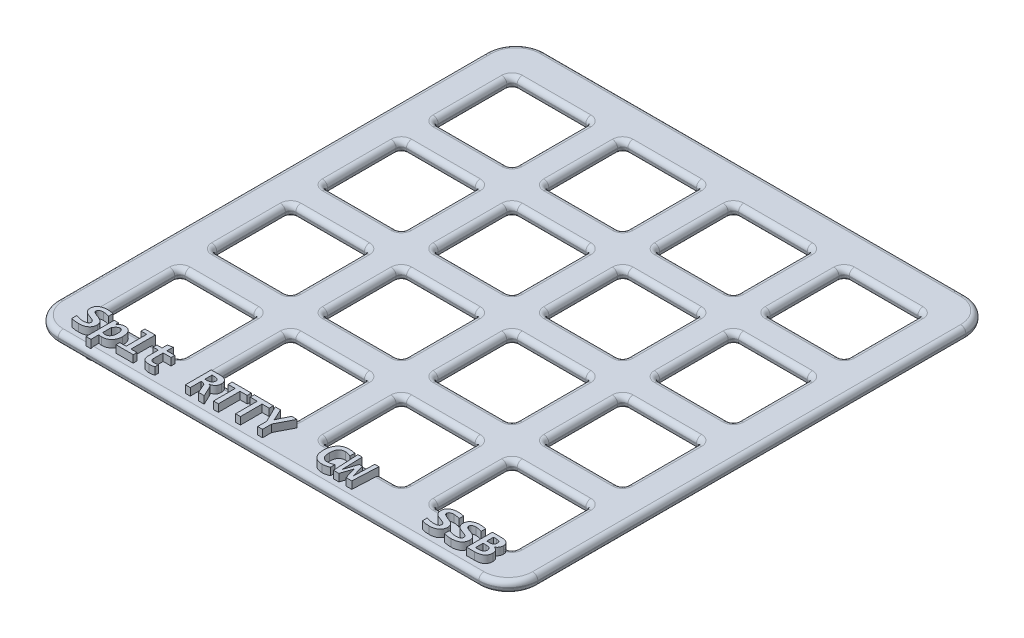
from build123d import *

# Parameters (mm, degrees)
MAIN_DEPTH                       = 1.5
SKETCH2_W                        = 10.7
SKETCH2_H                        = 10.7
BUTTON_HOLE_1_DEPTH              = 93.818144147
BUTTON_FILLET_R                  = 0.7
BUTTONS_BY_16_COUNT              = 4
BUTTONS_BY_16_PITCH              = 15
BUTTONS_BY_16_COUNT_DIR2         = 4
BUTTONS_BY_16_PITCH_DIR2         = 15
BUTTON_FILLET_OF_BUTTONS_BY_16_R = 0.7
OUTER_EDGE_FILLET_R              = 0.7
LETTERING_BOSS_DEPTH             = 2.5


with BuildPart() as part:
    # Sketch1 → main (new body)
    with BuildSketch(Plane(origin=(0, 0, 0), x_dir=(1, 0, 0), z_dir=(0, 1, 0))):
        with BuildLine():
            Line((-14.880741165, -14.535531583), (42.119258835, -14.535531583))
            ThreePointArc((42.119258835, -14.535531583), (44.94768596, -15.707104458), (46.119258835, -18.535531583))
            Line((46.119258835, -18.535531583), (46.119258835, -76.535531583))
            ThreePointArc((46.119258835, -76.535531583), (44.94768596, -79.363958708), (42.119258835, -80.535531583))
            Line((42.119258835, -80.535531583), (-14.880741165, -80.535531583))
            ThreePointArc((-14.880741165, -80.535531583), (-17.709168289, -79.363958708), (-18.880741165, -76.535531583))
            Line((-18.880741165, -76.535531583), (-18.880741165, -18.535531583))
            ThreePointArc((-18.880741165, -18.535531583), (-17.709168289, -15.707104458), (-14.880741165, -14.535531583))
        make_face()
    extrude(amount=MAIN_DEPTH)

    # Sketch2 → button hole 1 (cut, through all)
    with BuildSketch(Plane(origin=(0, 1.5, 0), x_dir=(1, 0, 0), z_dir=(0, 1, 0))):
        with Locations((-8.880741165, -25.035531583)):
            Rectangle(SKETCH2_W, SKETCH2_H)
    button_hole_1 = extrude(amount=-BUTTON_HOLE_1_DEPTH, mode=Mode.SUBTRACT)

    # button fillet
    button_fillet_edges = [part.edges().sort_by_distance(p)[0] for p in [
        (-8.880741165, 0, 30.385531583),
        (-8.880741165, 1.5, 30.385531583),
        (-8.880741165, 0, 19.685531583),
        (-8.880741165, 1.5, 19.685531583),
        (-3.530741165, 0.75, 30.385531583),
        (-3.530741165, 0, 25.035531583),
        (-3.530741165, 0.75, 19.685531583),
        (-3.530741165, 1.5, 25.035531583),
        (-14.230741165, 0.75, 19.685531583),
        (-14.230741165, 0, 25.035531583),
        (-14.230741165, 0.75, 30.385531583),
        (-14.230741165, 1.5, 25.035531583),
    ]]
    fillet(button_fillet_edges, radius=BUTTON_FILLET_R)

    # buttons by 16: button hole 1 4 × 4
    with Locations(*[(i * BUTTONS_BY_16_PITCH, 0, j * BUTTONS_BY_16_PITCH_DIR2) for i in range(BUTTONS_BY_16_COUNT) for j in range(BUTTONS_BY_16_COUNT_DIR2) if (i, j) != (0, 0)]):
        add(button_hole_1, mode=Mode.SUBTRACT)

    # button fillet of buttons by 16
    button_fillet_of_buttons_by_16_edges = [part.edges().sort_by_distance(p)[0] for p in [
        (-8.880741165, 0, 45.385531583),
        (-8.880741165, 1.5, 45.385531583),
        (-8.880741165, 0, 34.685531583),
        (-8.880741165, 1.5, 34.685531583),
        (-3.530741165, 0.75, 45.385531583),
        (-3.530741165, 0, 40.035531583),
        (-3.530741165, 0.75, 34.685531583),
        (-3.530741165, 1.5, 40.035531583),
        (-14.230741165, 0.75, 34.685531583),
        (-14.230741165, 0, 40.035531583),
        (-14.230741165, 0.75, 45.385531583),
        (-14.230741165, 1.5, 40.035531583),
        (-8.880741165, 0, 60.385531583),
        (-8.880741165, 1.5, 60.385531583),
        (-8.880741165, 0, 49.685531583),
        (-8.880741165, 1.5, 49.685531583),
        (-3.530741165, 0.75, 60.385531583),
        (-3.530741165, 0, 55.035531583),
        (-3.530741165, 0.75, 49.685531583),
        (-3.530741165, 1.5, 55.035531583),
        (-14.230741165, 0.75, 49.685531583),
        (-14.230741165, 0, 55.035531583),
        (-14.230741165, 0.75, 60.385531583),
        (-14.230741165, 1.5, 55.035531583),
        (-8.880741165, 0, 75.385531583),
        (-8.880741165, 1.5, 75.385531583),
        (-8.880741165, 0, 64.685531583),
        (-8.880741165, 1.5, 64.685531583),
        (-3.530741165, 0.75, 75.385531583),
        (-3.530741165, 0, 70.035531583),
        (-3.530741165, 0.75, 64.685531583),
        (-3.530741165, 1.5, 70.035531583),
        (-14.230741165, 0.75, 64.685531583),
        (-14.230741165, 0, 70.035531583),
        (-14.230741165, 0.75, 75.385531583),
        (-14.230741165, 1.5, 70.035531583),
        (6.119258835, 0, 30.385531583),
        (6.119258835, 1.5, 30.385531583),
        (6.119258835, 0, 19.685531583),
        (6.119258835, 1.5, 19.685531583),
        (11.469258835, 0.75, 30.385531583),
        (11.469258835, 0, 25.035531583),
        (11.469258835, 0.75, 19.685531583),
        (11.469258835, 1.5, 25.035531583),
        (0.769258835, 0.75, 19.685531583),
        (0.769258835, 0, 25.035531583),
        (0.769258835, 0.75, 30.385531583),
        (0.769258835, 1.5, 25.035531583),
        (6.119258835, 0, 45.385531583),
        (6.119258835, 1.5, 45.385531583),
        (6.119258835, 0, 34.685531583),
        (6.119258835, 1.5, 34.685531583),
        (11.469258835, 0.75, 45.385531583),
        (11.469258835, 0, 40.035531583),
        (11.469258835, 0.75, 34.685531583),
        (11.469258835, 1.5, 40.035531583),
        (0.769258835, 0.75, 34.685531583),
        (0.769258835, 0, 40.035531583),
        (0.769258835, 0.75, 45.385531583),
        (0.769258835, 1.5, 40.035531583),
        (6.119258835, 0, 60.385531583),
        (6.119258835, 1.5, 60.385531583),
        (6.119258835, 0, 49.685531583),
        (6.119258835, 1.5, 49.685531583),
        (11.469258835, 0.75, 60.385531583),
        (11.469258835, 0, 55.035531583),
        (11.469258835, 0.75, 49.685531583),
        (11.469258835, 1.5, 55.035531583),
        (0.769258835, 0.75, 49.685531583),
        (0.769258835, 0, 55.035531583),
        (0.769258835, 0.75, 60.385531583),
        (0.769258835, 1.5, 55.035531583),
        (6.119258835, 0, 75.385531583),
        (6.119258835, 1.5, 75.385531583),
        (6.119258835, 0, 64.685531583),
        (6.119258835, 1.5, 64.685531583),
        (11.469258835, 0.75, 75.385531583),
        (11.469258835, 0, 70.035531583),
        (11.469258835, 0.75, 64.685531583),
        (11.469258835, 1.5, 70.035531583),
        (0.769258835, 0.75, 64.685531583),
        (0.769258835, 0, 70.035531583),
        (0.769258835, 0.75, 75.385531583),
        (0.769258835, 1.5, 70.035531583),
        (21.119258835, 0, 30.385531583),
        (21.119258835, 1.5, 30.385531583),
        (21.119258835, 0, 19.685531583),
        (21.119258835, 1.5, 19.685531583),
        (26.469258835, 0.75, 30.385531583),
        (26.469258835, 0, 25.035531583),
        (26.469258835, 0.75, 19.685531583),
        (26.469258835, 1.5, 25.035531583),
        (15.769258835, 0.75, 19.685531583),
        (15.769258835, 0, 25.035531583),
        (15.769258835, 0.75, 30.385531583),
        (15.769258835, 1.5, 25.035531583),
        (21.119258835, 0, 45.385531583),
        (21.119258835, 1.5, 45.385531583),
        (21.119258835, 0, 34.685531583),
        (21.119258835, 1.5, 34.685531583),
        (26.469258835, 0.75, 45.385531583),
        (26.469258835, 0, 40.035531583),
        (26.469258835, 0.75, 34.685531583),
        (26.469258835, 1.5, 40.035531583),
        (15.769258835, 0.75, 34.685531583),
        (15.769258835, 0, 40.035531583),
        (15.769258835, 0.75, 45.385531583),
        (15.769258835, 1.5, 40.035531583),
        (21.119258835, 0, 60.385531583),
        (21.119258835, 1.5, 60.385531583),
        (21.119258835, 0, 49.685531583),
        (21.119258835, 1.5, 49.685531583),
        (26.469258835, 0.75, 60.385531583),
        (26.469258835, 0, 55.035531583),
        (26.469258835, 0.75, 49.685531583),
        (26.469258835, 1.5, 55.035531583),
        (15.769258835, 0.75, 49.685531583),
        (15.769258835, 0, 55.035531583),
        (15.769258835, 0.75, 60.385531583),
        (15.769258835, 1.5, 55.035531583),
        (21.119258835, 0, 75.385531583),
        (21.119258835, 1.5, 75.385531583),
        (21.119258835, 0, 64.685531583),
        (21.119258835, 1.5, 64.685531583),
        (26.469258835, 0.75, 75.385531583),
        (26.469258835, 0, 70.035531583),
        (26.469258835, 0.75, 64.685531583),
        (26.469258835, 1.5, 70.035531583),
        (15.769258835, 0.75, 64.685531583),
        (15.769258835, 0, 70.035531583),
        (15.769258835, 0.75, 75.385531583),
        (15.769258835, 1.5, 70.035531583),
        (36.119258835, 0, 30.385531583),
        (36.119258835, 1.5, 30.385531583),
        (36.119258835, 0, 19.685531583),
        (36.119258835, 1.5, 19.685531583),
        (41.469258835, 0.75, 30.385531583),
        (41.469258835, 0, 25.035531583),
        (41.469258835, 0.75, 19.685531583),
        (41.469258835, 1.5, 25.035531583),
        (30.769258835, 0.75, 19.685531583),
        (30.769258835, 0, 25.035531583),
        (30.769258835, 0.75, 30.385531583),
        (30.769258835, 1.5, 25.035531583),
        (36.119258835, 0, 45.385531583),
        (36.119258835, 1.5, 45.385531583),
        (36.119258835, 0, 34.685531583),
        (36.119258835, 1.5, 34.685531583),
        (41.469258835, 0.75, 45.385531583),
        (41.469258835, 0, 40.035531583),
        (41.469258835, 0.75, 34.685531583),
        (41.469258835, 1.5, 40.035531583),
        (30.769258835, 0.75, 34.685531583),
        (30.769258835, 0, 40.035531583),
        (30.769258835, 0.75, 45.385531583),
        (30.769258835, 1.5, 40.035531583),
        (36.119258835, 0, 60.385531583),
        (36.119258835, 1.5, 60.385531583),
        (36.119258835, 0, 49.685531583),
        (36.119258835, 1.5, 49.685531583),
        (41.469258835, 0.75, 60.385531583),
        (41.469258835, 0, 55.035531583),
        (41.469258835, 0.75, 49.685531583),
        (41.469258835, 1.5, 55.035531583),
        (30.769258835, 0.75, 49.685531583),
        (30.769258835, 0, 55.035531583),
        (30.769258835, 0.75, 60.385531583),
        (30.769258835, 1.5, 55.035531583),
        (36.119258835, 0, 75.385531583),
        (36.119258835, 1.5, 75.385531583),
        (36.119258835, 0, 64.685531583),
        (36.119258835, 1.5, 64.685531583),
        (41.469258835, 0.75, 75.385531583),
        (41.469258835, 0, 70.035531583),
        (41.469258835, 0.75, 64.685531583),
        (41.469258835, 1.5, 70.035531583),
        (30.769258835, 0.75, 64.685531583),
        (30.769258835, 0, 70.035531583),
        (30.769258835, 0.75, 75.385531583),
        (30.769258835, 1.5, 70.035531583),
    ]]
    fillet(button_fillet_of_buttons_by_16_edges, radius=BUTTON_FILLET_OF_BUTTONS_BY_16_R)

    # outer edge fillet
    outer_edge_fillet_edges = [part.edges().sort_by_distance(p)[0] for p in [
        (13.619258835, 1.5, 14.535531583),
        (13.619258835, 0, 14.535531583),
        (46.119258835, 1.5, 47.535531583),
        (46.119258835, 0, 47.535531583),
        (13.619258835, 1.5, 80.535531583),
        (13.619258835, 0, 80.535531583),
        (-18.880741165, 1.5, 47.535531583),
        (-18.880741165, 0, 47.535531583),
        (44.94768596, 1.5, 15.707104458),
        (44.94768596, 1.5, 79.363958708),
        (-17.709168289, 1.5, 79.363958708),
        (-17.709168289, 1.5, 15.707104458),
        (44.94768596, 0, 15.707104458),
        (44.94768596, 0, 79.363958708),
        (-17.709168289, 0, 79.363958708),
        (-17.709168289, 0, 15.707104458),
    ]]
    fillet(outer_edge_fillet_edges, radius=OUTER_EDGE_FILLET_R)

    # Lettering → lettering boss (add)
    # profile 1 of 13: a face of its own
    with BuildSketch(Plane(origin=(0, 0, 0), x_dir=(1, 0, 0), z_dir=(0, 1, 0))):
        with BuildLine():
            add(Edge.make_bspline(
                [(35.461192996, -78.072691909), (35.460219938, -78.118754507), (35.458330304, -78.208205957), (35.436683824, -78.337558753), (35.404146648, -78.458150303), (35.356871415, -78.569020514), (35.297849953, -78.670145601), (35.228271235, -78.762346077), (35.147849394, -78.84512241), (35.056676983, -78.918182679), (34.956202124, -78.982599991), (34.846563905, -79.03817851), (34.727356813, -79.083922022), (34.60014988, -79.121727685), (34.465263025, -79.150939713), (34.323804391, -79.171063334), (34.17615797, -79.184325826), (34.075541922, -79.185604497), (34.02425912, -79.186256221)],
                knots=[0, 0, 0, 0, 1.073681499, 2.085040185, 3.051149047, 3.981944283, 4.887978953, 5.776845786, 6.670466122, 7.573455289, 8.49677068, 9.450589821, 10.436166866, 11.471749255, 12.544173733, 13.653021529, 14.803772988, 16, 16, 16, 16], degree=3))
            add(Edge.make_bspline(
                [(34.02425912, -79.186256221), (33.933317541, -79.184576543), (33.753956378, -79.181263769), (33.48856806, -79.155083882), (33.228676809, -79.108055718), (33.060379735, -79.058846435), (32.97568575, -79.034082307)],
                knots=[0, 0, 0, 0, 1.025764599, 2.023082686, 3.005134181, 4, 4, 4, 4], degree=3))
            Line((32.97568575, -79.034082307), (32.97568575, -78.374662018))
            add(Edge.make_bspline(
                [(32.97568575, -78.374662018), (33.018439663, -78.388274658), (33.105246895, -78.415913665), (33.237527488, -78.455161652), (33.373409396, -78.488440968), (33.51010859, -78.519067388), (33.647120187, -78.54339105), (33.783175795, -78.562708611), (33.917032304, -78.575143008), (34.005476579, -78.576765352), (34.048828866, -78.577560568)],
                knots=[0, 0, 0, 0, 0.982138956, 1.994127776, 3.019379675, 4.043652595, 5.060010385, 6.064286964, 7.051181246, 8, 8, 8, 8], degree=3))
            add(Edge.make_bspline(
                [(34.048828866, -78.577560568), (34.079483437, -78.577344081), (34.138206785, -78.576929368), (34.222883387, -78.571371353), (34.300112613, -78.561920475), (34.370914891, -78.549490037), (34.434595377, -78.532763313), (34.492509693, -78.513882948), (34.54389405, -78.491729123), (34.589828685, -78.467217621), (34.629193063, -78.439492495), (34.663478373, -78.409932443), (34.69132107, -78.377177044), (34.720998052, -78.330630302), (34.745804733, -78.265164811), (34.74928272, -78.210044658), (34.751048069, -78.182066909)],
                knots=[0, 0, 0, 0, 1.428616996, 2.73672639, 3.952495327, 5.053878092, 6.0842745, 7.018828766, 7.890331589, 8.689308687, 9.440856164, 10.130100935, 10.793906804, 11.436117796, 12.698631087, 14, 14, 14, 14], degree=3))
            add(Edge.make_bspline(
                [(34.751048069, -78.182066909), (34.750093692, -78.161661255), (34.748237167, -78.121966637), (34.734977728, -78.064648206), (34.71040196, -78.013113569), (34.677322971, -77.966756363), (34.636551645, -77.924783594), (34.59117636, -77.883974108), (34.53783873, -77.848048065), (34.459156631, -77.800395294), (34.347847102, -77.747085562), (34.201586397, -77.693270589), (34.046689287, -77.638936463), (33.887415467, -77.581490004), (33.728896916, -77.515390595), (33.597775581, -77.456259305), (33.496922977, -77.401704077), (33.425727716, -77.355764053), (33.358644273, -77.305232749), (33.294998405, -77.251068159), (33.236891983, -77.190722285), (33.185463063, -77.12446183), (33.138954468, -77.053357109), (33.09830093, -76.976509382), (33.065054636, -76.892254134), (33.042671403, -76.799998883), (33.02904602, -76.699835006), (33.027310942, -76.630520469), (33.026410388, -76.594544264)],
                knots=[0, 0, 0, 0, 0.628577789, 1.222756944, 1.798018064, 2.376093337, 2.969100815, 3.597678604, 4.252424917, 4.946124793, 6.431204757, 8.043936516, 9.745465074, 11.488681512, 13.25853968, 15.035457213, 15.916880054, 16.788288763, 17.642849837, 18.502665518, 19.360321436, 20.218324825, 21.082903639, 21.974822425, 22.892221362, 23.865363472, 24.892063288, 26, 26, 26, 26], degree=3))
            add(Edge.make_bspline(
                [(33.026410388, -76.594544264), (33.027274108, -76.560670177), (33.0289824, -76.493673001), (33.04415211, -76.394792401), (33.066631419, -76.298171014), (33.100120009, -76.205000982), (33.142627892, -76.115346769), (33.197269293, -76.031893245), (33.261663821, -75.95351691), (33.337769728, -75.881972697), (33.424562998, -75.816652376), (33.523012291, -75.75903275), (33.631968598, -75.707026656), (33.753180736, -75.663973457), (33.886225231, -75.62760361), (34.032541014, -75.603386426), (34.19163711, -75.586761566), (34.302140038, -75.585474986), (34.359517272, -75.584806945)],
                knots=[0, 0, 0, 0, 0.86106195, 1.703033948, 2.539139973, 3.380790137, 4.216301896, 5.056905248, 5.911254958, 6.790607679, 7.707171391, 8.668295362, 9.687250551, 10.773449095, 11.935660323, 13.190638171, 14.54127474, 16, 16, 16, 16], degree=3))
            add(Edge.make_bspline(
                [(34.359517272, -75.584806945), (34.395192595, -75.585328122), (34.468179527, -75.586394381), (34.578896885, -75.593192523), (34.69124805, -75.602352865), (34.802717558, -75.615291702), (34.911655597, -75.62997727), (35.01615136, -75.647768483), (35.114685419, -75.665116669), (35.177500591, -75.67941277), (35.207569808, -75.686256221)],
                knots=[0, 0, 0, 0, 1.000632186, 2.047159369, 3.110551158, 4.162103459, 5.194366354, 6.193323381, 7.135155576, 8, 8, 8, 8], degree=3))
            Line((35.207569808, -75.686256221), (35.207569808, -76.294951873))
            add(Edge.make_bspline(
                [(35.207569808, -76.294951873), (35.17755424, -76.284076418), (35.115389321, -76.261552381), (35.017882443, -76.233039217), (34.914896829, -76.206571669), (34.807944602, -76.184965323), (34.698833511, -76.166419449), (34.589839247, -76.153504356), (34.483329743, -76.143838304), (34.413432739, -76.143125648), (34.379331583, -76.14277796)],
                knots=[0, 0, 0, 0, 0.905300762, 1.874958649, 2.879989676, 3.920459461, 4.968805495, 6.018141936, 7.033096622, 8, 8, 8, 8], degree=3))
            add(Edge.make_bspline(
                [(34.379331583, -76.14277796), (34.351314338, -76.142973959), (34.297332983, -76.143351593), (34.219861571, -76.149221763), (34.14880624, -76.157352156), (34.084645979, -76.170438094), (34.026198867, -76.185096368), (33.973856888, -76.20350348), (33.926411551, -76.223964621), (33.884590384, -76.247790061), (33.847391354, -76.273528612), (33.817014432, -76.303956514), (33.790458948, -76.335782043), (33.764272916, -76.383308933), (33.741009556, -76.448817433), (33.738068433, -76.504220459), (33.736555315, -76.532723612)],
                knots=[0, 0, 0, 0, 1.388230333, 2.674729552, 3.848979118, 4.930101904, 5.917823404, 6.833012122, 7.677256906, 8.474713018, 9.216010271, 9.910495862, 10.599653, 11.262301414, 12.591538262, 14, 14, 14, 14], degree=3))
            add(Edge.make_bspline(
                [(33.736555315, -76.532723612), (33.737455619, -76.550519959), (33.739203448, -76.585069351), (33.753342619, -76.634928436), (33.77654148, -76.680867781), (33.809977093, -76.722004976), (33.850319289, -76.760011163), (33.896270924, -76.796655217), (33.94898437, -76.830353208), (34.028107231, -76.87474687), (34.139650508, -76.92480093), (34.284653433, -76.981066224), (34.44056414, -77.034816895), (34.599699077, -77.095990815), (34.759872573, -77.161027453), (34.889713197, -77.224533677), (34.9907355, -77.279743737), (35.061879067, -77.32656744), (35.129020188, -77.377817306), (35.192166921, -77.432762858), (35.25066594, -77.492554967), (35.303221834, -77.557665228), (35.349075684, -77.628483676), (35.389232061, -77.704335812), (35.422153956, -77.786142297), (35.445100252, -77.875348129), (35.458456558, -77.971628224), (35.46026189, -78.03830377), (35.461192996, -78.072691909)],
                knots=[0, 0, 0, 0, 0.557156268, 1.081649532, 1.611348813, 2.159818371, 2.733894156, 3.347031838, 3.999468898, 4.692937397, 6.19005387, 7.82657883, 9.568786128, 11.359307707, 13.171290529, 14.986394118, 15.88741221, 16.778746798, 17.653416553, 18.53387112, 19.400741367, 20.27258301, 21.152453011, 22.041629961, 22.959843454, 23.910073311, 24.922113205, 26, 26, 26, 26], degree=3))
        make_face()
    # profile 2 of 13: a face of its own
    with BuildSketch(Plane(origin=(0, 0, 0), x_dir=(1, 0, 0), z_dir=(0, 1, 0))):
        with BuildLine():
            add(Edge.make_bspline(
                [(38.45394662, -78.072691909), (38.452973561, -78.118754507), (38.451083927, -78.208205957), (38.429437447, -78.337558753), (38.396900271, -78.458150303), (38.349625038, -78.569020514), (38.290603576, -78.670145601), (38.221024858, -78.762346077), (38.140603017, -78.84512241), (38.049430606, -78.918182679), (37.948955747, -78.982599991), (37.839317528, -79.03817851), (37.720110436, -79.083922022), (37.592903503, -79.121727685), (37.458016648, -79.150939713), (37.316558014, -79.171063334), (37.168911593, -79.184325826), (37.068295545, -79.185604497), (37.017012743, -79.186256221)],
                knots=[0, 0, 0, 0, 1.073681499, 2.085040185, 3.051149047, 3.981944283, 4.887978953, 5.776845786, 6.670466122, 7.573455289, 8.49677068, 9.450589821, 10.436166866, 11.471749255, 12.544173733, 13.653021529, 14.803772988, 16, 16, 16, 16], degree=3))
            add(Edge.make_bspline(
                [(37.017012743, -79.186256221), (36.926071164, -79.184576543), (36.746710001, -79.181263769), (36.481321683, -79.155083882), (36.221430432, -79.108055718), (36.053133358, -79.058846435), (35.968439373, -79.034082307)],
                knots=[0, 0, 0, 0, 1.025764599, 2.023082686, 3.005134181, 4, 4, 4, 4], degree=3))
            Line((35.968439373, -79.034082307), (35.968439373, -78.374662018))
            add(Edge.make_bspline(
                [(35.968439373, -78.374662018), (36.011193286, -78.388274658), (36.098000518, -78.415913665), (36.230281112, -78.455161652), (36.366163019, -78.488440968), (36.502862214, -78.519067388), (36.63987381, -78.54339105), (36.775929418, -78.562708611), (36.909785927, -78.575143008), (36.998230202, -78.576765352), (37.041582489, -78.577560568)],
                knots=[0, 0, 0, 0, 0.982138956, 1.994127776, 3.019379675, 4.043652595, 5.060010385, 6.064286964, 7.051181246, 8, 8, 8, 8], degree=3))
            add(Edge.make_bspline(
                [(37.041582489, -78.577560568), (37.07223706, -78.577344081), (37.130960408, -78.576929368), (37.215637011, -78.571371353), (37.292866237, -78.561920475), (37.363668514, -78.549490037), (37.427349, -78.532763313), (37.485263316, -78.513882948), (37.536647673, -78.491729123), (37.582582308, -78.467217621), (37.621946686, -78.439492495), (37.656231997, -78.409932443), (37.684074693, -78.377177044), (37.713751675, -78.330630302), (37.738558356, -78.265164811), (37.742036344, -78.210044658), (37.743801692, -78.182066909)],
                knots=[0, 0, 0, 0, 1.428616996, 2.73672639, 3.952495327, 5.053878092, 6.0842745, 7.018828766, 7.890331589, 8.689308687, 9.440856164, 10.130100935, 10.793906804, 11.436117796, 12.698631087, 14, 14, 14, 14], degree=3))
            add(Edge.make_bspline(
                [(37.743801692, -78.182066909), (37.742847315, -78.161661255), (37.74099079, -78.121966637), (37.727731351, -78.064648206), (37.703155584, -78.013113569), (37.670076594, -77.966756363), (37.629305268, -77.924783594), (37.583929984, -77.883974108), (37.530592353, -77.848048065), (37.451910254, -77.800395294), (37.340600725, -77.747085562), (37.194340021, -77.693270589), (37.03944291, -77.638936463), (36.880169091, -77.581490004), (36.721650539, -77.515390595), (36.590529204, -77.456259305), (36.4896766, -77.401704077), (36.41848134, -77.355764053), (36.351397896, -77.305232749), (36.287752028, -77.251068159), (36.229645607, -77.190722285), (36.178216686, -77.12446183), (36.131708091, -77.053357109), (36.091054553, -76.976509382), (36.057808259, -76.892254134), (36.035425026, -76.799998883), (36.021799643, -76.699835006), (36.020064565, -76.630520469), (36.019164011, -76.594544264)],
                knots=[0, 0, 0, 0, 0.628577789, 1.222756944, 1.798018064, 2.376093337, 2.969100815, 3.597678604, 4.252424917, 4.946124793, 6.431204757, 8.043936516, 9.745465074, 11.488681512, 13.25853968, 15.035457213, 15.916880054, 16.788288763, 17.642849837, 18.502665518, 19.360321436, 20.218324825, 21.082903639, 21.974822425, 22.892221362, 23.865363472, 24.892063288, 26, 26, 26, 26], degree=3))
            add(Edge.make_bspline(
                [(36.019164011, -76.594544264), (36.020027731, -76.560670177), (36.021736023, -76.493673001), (36.036905733, -76.394792401), (36.059385043, -76.298171014), (36.092873632, -76.205000982), (36.135381515, -76.115346769), (36.190022916, -76.031893245), (36.254417445, -75.95351691), (36.330523351, -75.881972697), (36.417316621, -75.816652376), (36.515765914, -75.75903275), (36.624722222, -75.707026656), (36.745934359, -75.663973457), (36.878978854, -75.62760361), (37.025294637, -75.603386426), (37.184390733, -75.586761566), (37.294893661, -75.585474986), (37.352270895, -75.584806945)],
                knots=[0, 0, 0, 0, 0.86106195, 1.703033948, 2.539139973, 3.380790137, 4.216301896, 5.056905248, 5.911254958, 6.790607679, 7.707171391, 8.668295362, 9.687250551, 10.773449095, 11.935660323, 13.190638171, 14.54127474, 16, 16, 16, 16], degree=3))
            add(Edge.make_bspline(
                [(37.352270895, -75.584806945), (37.387946219, -75.585328122), (37.460933151, -75.586394381), (37.571650508, -75.593192523), (37.684001673, -75.602352865), (37.795471181, -75.615291702), (37.90440922, -75.62997727), (38.008904983, -75.647768483), (38.107439042, -75.665116669), (38.170254214, -75.67941277), (38.200323431, -75.686256221)],
                knots=[0, 0, 0, 0, 1.000632186, 2.047159369, 3.110551158, 4.162103459, 5.194366354, 6.193323381, 7.135155576, 8, 8, 8, 8], degree=3))
            Line((38.200323431, -75.686256221), (38.200323431, -76.294951873))
            add(Edge.make_bspline(
                [(38.200323431, -76.294951873), (38.170307863, -76.284076418), (38.108142944, -76.261552381), (38.010636066, -76.233039217), (37.907650453, -76.206571669), (37.800698225, -76.184965323), (37.691587134, -76.166419449), (37.582592871, -76.153504356), (37.476083366, -76.143838304), (37.406186362, -76.143125648), (37.372085206, -76.14277796)],
                knots=[0, 0, 0, 0, 0.905300762, 1.874958649, 2.879989676, 3.920459461, 4.968805495, 6.018141936, 7.033096622, 8, 8, 8, 8], degree=3))
            add(Edge.make_bspline(
                [(37.372085206, -76.14277796), (37.344067961, -76.142973959), (37.290086606, -76.143351593), (37.212615194, -76.149221763), (37.141559863, -76.157352156), (37.077399603, -76.170438094), (37.018952491, -76.185096368), (36.966610512, -76.20350348), (36.919165174, -76.223964621), (36.877344007, -76.247790061), (36.840144977, -76.273528612), (36.809768055, -76.303956514), (36.783212571, -76.335782043), (36.75702654, -76.383308933), (36.733763179, -76.448817433), (36.730822056, -76.504220459), (36.729308938, -76.532723612)],
                knots=[0, 0, 0, 0, 1.388230333, 2.674729552, 3.848979118, 4.930101904, 5.917823404, 6.833012122, 7.677256906, 8.474713018, 9.216010271, 9.910495862, 10.599653, 11.262301414, 12.591538262, 14, 14, 14, 14], degree=3))
            add(Edge.make_bspline(
                [(36.729308938, -76.532723612), (36.730209243, -76.550519959), (36.731957071, -76.585069351), (36.746096242, -76.634928436), (36.769295103, -76.680867781), (36.802730716, -76.722004976), (36.843072912, -76.760011163), (36.889024547, -76.796655217), (36.941737994, -76.830353208), (37.020860854, -76.87474687), (37.132404131, -76.92480093), (37.277407056, -76.981066224), (37.433317763, -77.034816895), (37.5924527, -77.095990815), (37.752626196, -77.161027453), (37.88246682, -77.224533677), (37.983489123, -77.279743737), (38.05463269, -77.32656744), (38.121773811, -77.377817306), (38.184920545, -77.432762858), (38.243419563, -77.492554967), (38.295975457, -77.557665228), (38.341829308, -77.628483676), (38.381985684, -77.704335812), (38.414907579, -77.786142297), (38.437853875, -77.875348129), (38.451210181, -77.971628224), (38.453015513, -78.03830377), (38.45394662, -78.072691909)],
                knots=[0, 0, 0, 0, 0.557156268, 1.081649532, 1.611348813, 2.159818371, 2.733894156, 3.347031838, 3.999468898, 4.692937397, 6.19005387, 7.82657883, 9.568786128, 11.359307707, 13.171290529, 14.986394118, 15.88741221, 16.778746798, 17.653416553, 18.53387112, 19.400741367, 20.27258301, 21.152453011, 22.041629961, 22.959843454, 23.910073311, 24.922113205, 26, 26, 26, 26], degree=3))
        make_face()
    # profile 3 of 13: a face of its own
    with BuildSketch(Plane(origin=(0, 0, 0), x_dir=(1, 0, 0), z_dir=(0, 1, 0))):
        with BuildLine():
            Line((39.062642272, -79.135531583), (39.062642272, -75.635531583))
            Line((39.062642272, -75.635531583), (40.196813467, -75.635531583))
            add(Edge.make_bspline(
                [(40.196813467, -75.635531583), (40.245178192, -75.636098997), (40.339100088, -75.637200886), (40.475072573, -75.646831719), (40.601988486, -75.662103475), (40.719094589, -75.685470439), (40.827637444, -75.713092876), (40.926127576, -75.749469373), (41.016418561, -75.789675513), (41.096258805, -75.838884443), (41.167381398, -75.893170298), (41.228583951, -75.955192176), (41.279894106, -76.023765881), (41.324008733, -76.098126161), (41.35584414, -76.180270745), (41.378838044, -76.268578041), (41.393476313, -76.363157751), (41.395127413, -76.428577606), (41.395975605, -76.462184663)],
                knots=[0, 0, 0, 0, 1.402020869, 2.722654989, 3.950110139, 5.105271457, 6.182839017, 7.193223738, 8.145991228, 9.043198014, 9.905766409, 10.734443583, 11.560141935, 12.38384842, 13.232981204, 14.104313047, 15.026160196, 16, 16, 16, 16], degree=3))
            add(Edge.make_bspline(
                [(41.395975605, -76.462184663), (41.394372626, -76.504813464), (41.391183109, -76.58963387), (41.368095766, -76.714076062), (41.328733885, -76.83209865), (41.272052643, -76.94074928), (41.199153957, -77.038790152), (41.124952646, -77.109755322), (41.057732342, -77.158978767), (41.002853054, -77.192666373), (40.943155755, -77.221083099), (40.901274304, -77.236583879), (40.880010931, -77.244453684)],
                knots=[0, 0, 0, 0, 1.273298406, 2.533538006, 3.766639183, 4.977638108, 6.179029059, 7.401702507, 8.028476186, 8.666091093, 9.322769338, 10, 10, 10, 10], degree=3))
            add(Edge.make_bspline(
                [(40.880010931, -77.244453684), (40.924092927, -77.253415804), (41.012836537, -77.271457884), (41.116554626, -77.318521271), (41.195993826, -77.362677478), (41.250483299, -77.403312963), (41.302800019, -77.446555681), (41.349864078, -77.496071487), (41.393939622, -77.54913733), (41.432746479, -77.607005498), (41.46625352, -77.669844968), (41.495445454, -77.736781767), (41.519493225, -77.807971431), (41.535981335, -77.883719883), (41.546598448, -77.963276751), (41.547627121, -78.017969474), (41.548149518, -78.045744445)],
                knots=[0, 0, 0, 0, 1.6519262, 3.32557291, 4.166740498, 4.995835318, 5.824301884, 6.663779587, 7.507195088, 8.362647254, 9.224604015, 10.126598034, 11.049652309, 11.986803716, 12.977625078, 14, 14, 14, 14], degree=3))
            add(Edge.make_bspline(
                [(41.548149518, -78.045744445), (41.54724251, -78.089669343), (41.545475463, -78.175244507), (41.527219579, -78.299103252), (41.500235564, -78.414986027), (41.460524003, -78.522200043), (41.408203846, -78.620157753), (41.346450718, -78.710946587), (41.271624649, -78.792076902), (41.186413706, -78.865448196), (41.090213209, -78.929637807), (40.983367952, -78.984086709), (40.867860841, -79.032123105), (40.741482345, -79.069455019), (40.605764744, -79.100136652), (40.459303344, -79.119394737), (40.303309725, -79.133966189), (40.195795086, -79.135000187), (40.140540822, -79.135531583)],
                knots=[0, 0, 0, 0, 1.039371005, 2.024918617, 2.958047709, 3.852767572, 4.723053758, 5.582001921, 6.445494094, 7.328259018, 8.239147345, 9.176460892, 10.16391264, 11.196919877, 12.292741297, 13.455226912, 14.692182175, 16, 16, 16, 16], degree=3))
            Line((40.140540822, -79.135531583), (39.062642272, -79.135531583))
        make_face()
        with BuildLine():
            add(Edge.make_bspline(
                [(40.685830677, -76.569974518), (40.684401154, -76.53891651), (40.681630525, -76.478721492), (40.661354014, -76.40650229), (40.636751108, -76.35504987), (40.614243654, -76.319357793), (40.586631643, -76.286895266), (40.55329766, -76.258265835), (40.516045453, -76.231922328), (40.473677339, -76.209016138), (40.42646163, -76.189043088), (40.374106158, -76.172754776), (40.316716069, -76.158972472), (40.253562026, -76.150014365), (40.184810704, -76.143134329), (40.136862043, -76.14289962), (40.112008214, -76.14277796)],
                knots=[0, 0, 0, 0, 1.599357931, 3.099792517, 3.824733362, 4.535069213, 5.269290696, 6.012427379, 6.794603599, 7.61746315, 8.490210935, 9.433542011, 10.441150938, 11.529478764, 12.719423833, 14, 14, 14, 14], degree=3))
            Line((40.112008214, -76.14277796), (39.722062562, -76.14277796))
            Line((39.722062562, -76.14277796), (39.722062562, -77.055821438))
            Line((39.722062562, -77.055821438), (40.112008214, -77.055821438))
            add(Edge.make_bspline(
                [(40.112008214, -77.055821438), (40.137388214, -77.055404031), (40.18614316, -77.054602193), (40.256124072, -77.047461043), (40.319811536, -77.03577893), (40.377580771, -77.019327924), (40.429376677, -76.997195067), (40.47683517, -76.973436582), (40.518959181, -76.944934479), (40.567874298, -76.903296933), (40.619272464, -76.843207997), (40.658512558, -76.758164879), (40.682381985, -76.666409386), (40.684663132, -76.602622272), (40.685830677, -76.569974518)],
                knots=[0, 0, 0, 0, 1.069032976, 2.053610886, 2.959553848, 3.794328356, 4.577732592, 5.329421169, 6.02708937, 6.714020821, 8.033657071, 9.318040837, 10.627309837, 12, 12, 12, 12], degree=3))
        make_face(mode=Mode.SUBTRACT)
        with BuildLine():
            add(Edge.make_bspline(
                [(40.188887743, -78.577560568), (40.214801479, -78.577203479), (40.265174226, -78.576509345), (40.338027559, -78.568323342), (40.405891039, -78.55576795), (40.468842809, -78.538479154), (40.526992632, -78.515934067), (40.580508564, -78.490326919), (40.629195694, -78.460415626), (40.672572093, -78.426662532), (40.710771693, -78.388674303), (40.745390638, -78.348885563), (40.772948616, -78.304198454), (40.804819509, -78.242290728), (40.832504086, -78.157291725), (40.836155512, -78.086399595), (40.838004591, -78.05049988)],
                knots=[0, 0, 0, 0, 1.157126176, 2.249294499, 3.270071966, 4.237898203, 5.160636285, 6.052674293, 6.8846023, 7.708539307, 8.501376315, 9.288660001, 10.058048539, 10.83920472, 12.39937595, 14, 14, 14, 14], degree=3))
            add(Edge.make_bspline(
                [(40.838004591, -78.05049988), (40.837696432, -78.031968549), (40.837089646, -77.99547911), (40.827939928, -77.942633519), (40.814228554, -77.892820439), (40.796655056, -77.845632876), (40.771137989, -77.802446933), (40.741379616, -77.762050568), (40.705614355, -77.725184849), (40.665370695, -77.690907383), (40.618938827, -77.660780568), (40.567080937, -77.634625862), (40.509481305, -77.612351485), (40.446022729, -77.594385533), (40.376866619, -77.580281051), (40.302239757, -77.569844032), (40.221717044, -77.56476284), (40.166172712, -77.563646623), (40.137370533, -77.563067815)],
                knots=[0, 0, 0, 0, 0.919965197, 1.811473402, 2.655599999, 3.487070925, 4.30463685, 5.139728507, 5.975542427, 6.851443155, 7.761895275, 8.719057734, 9.733411133, 10.826385967, 11.992916024, 13.238912289, 14.568254558, 16, 16, 16, 16], degree=3))
            Line((40.137370533, -77.563067815), (39.722062562, -77.563067815))
            Line((39.722062562, -77.563067815), (39.722062562, -78.577560568))
            Line((39.722062562, -78.577560568), (40.188887743, -78.577560568))
        make_face(mode=Mode.SUBTRACT)
    # profile 4 of 13: a face of its own
    with BuildSketch(Plane(origin=(0, 0, 0), x_dir=(1, 0, 0), z_dir=(0, 1, 0))):
        with BuildLine():
            add(Edge.make_bspline(
                [(20.464468356, -78.98335767), (20.425789951, -78.999868979), (20.349904108, -79.032263661), (20.235202802, -79.073336527), (20.122594959, -79.10843205), (20.011005447, -79.137142629), (19.899207683, -79.16000966), (19.785777766, -79.174309587), (19.670234046, -79.18457964), (19.592398101, -79.185692878), (19.553010023, -79.186256221)],
                knots=[0, 0, 0, 0, 1.072602722, 2.104413604, 3.106297595, 4.08050826, 5.042709706, 6.014913564, 6.995467464, 8, 8, 8, 8], degree=3))
            add(Edge.make_bspline(
                [(19.553010023, -79.186256221), (19.491394226, -79.184907641), (19.371764013, -79.182289304), (19.197454, -79.161399055), (19.034227865, -79.12688717), (18.881507478, -79.078707515), (18.740424543, -79.015755291), (18.610308682, -78.939328253), (18.491405203, -78.849409306), (18.384538514, -78.745510599), (18.28952109, -78.628355027), (18.207903909, -78.496887198), (18.137138282, -78.353148583), (18.079318987, -78.195849632), (18.034327812, -78.025452953), (18.0024488, -77.841961732), (17.982068522, -77.645426133), (17.980018069, -77.510018474), (17.978961109, -77.440219083)],
                knots=[0, 0, 0, 0, 1.102605573, 2.140764961, 3.136846793, 4.08496906, 5.001529512, 5.896051515, 6.780328523, 7.66316301, 8.557497515, 9.473264751, 10.427030373, 11.420482266, 12.467702166, 13.577100782, 14.751053738, 16, 16, 16, 16], degree=3))
            add(Edge.make_bspline(
                [(17.978961109, -77.440219083), (17.980229205, -77.368561784), (17.982701187, -77.228875517), (18.004803502, -77.025732982), (18.038661188, -76.834280241), (18.089116673, -76.65578873), (18.151180318, -76.489380197), (18.226957697, -76.33680413), (18.313262121, -76.196660539), (18.413009181, -76.070857498), (18.524239796, -75.958455631), (18.647397168, -75.860487848), (18.780979091, -75.775752253), (18.926495838, -75.706765455), (19.081955381, -75.652316644), (19.246979354, -75.612307057), (19.421587541, -75.589378299), (19.541054586, -75.586353708), (19.602149515, -75.584806945)],
                knots=[0, 0, 0, 0, 1.232307787, 2.402218284, 3.511138658, 4.573037126, 5.588482404, 6.562047137, 7.499038646, 8.414657469, 9.317692522, 10.213424542, 11.116219401, 12.033010505, 12.977368732, 13.94518829, 14.949178196, 16, 16, 16, 16], degree=3))
            add(Edge.make_bspline(
                [(19.602149515, -75.584806945), (19.64125682, -75.584771481), (19.717116197, -75.584702689), (19.828050429, -75.58955373), (19.934452011, -75.593866944), (20.038467451, -75.605268123), (20.142300689, -75.617806106), (20.247180629, -75.637407206), (20.355267439, -75.657497818), (20.427586334, -75.676543225), (20.464468356, -75.686256221)],
                knots=[0, 0, 0, 0, 1.077376558, 2.089868288, 3.059369192, 4.010411707, 4.972009834, 5.940198088, 6.949518525, 8, 8, 8, 8], degree=3))
            Line((20.464468356, -75.686256221), (20.464468356, -76.34567651))
            add(Edge.make_bspline(
                [(20.464468356, -76.34567651), (20.426614475, -76.328318002), (20.352490939, -76.294327459), (20.240292579, -76.251964), (20.131383464, -76.215546423), (20.024869721, -76.189237753), (19.922832275, -76.168277684), (19.824891403, -76.154135256), (19.731777214, -76.144940414), (19.671122669, -76.143483036), (19.641778138, -76.14277796)],
                knots=[0, 0, 0, 0, 1.170030163, 2.291093263, 3.368831198, 4.395296508, 5.372370687, 6.295361994, 7.175300008, 8, 8, 8, 8], degree=3))
            add(Edge.make_bspline(
                [(19.641778138, -76.14277796), (19.601034134, -76.143773111), (19.522351546, -76.145694894), (19.408717366, -76.162411392), (19.304283949, -76.190690853), (19.209177798, -76.230749151), (19.12261107, -76.280539149), (19.043595329, -76.339086633), (18.973543809, -76.408090924), (18.911530487, -76.485375426), (18.857311027, -76.571100024), (18.810781744, -76.664636258), (18.771706296, -76.765983941), (18.741379222, -76.87467329), (18.717586859, -76.989619717), (18.701431808, -77.110411645), (18.69059837, -77.236593926), (18.689610076, -77.322630428), (18.689106037, -77.366509844)],
                knots=[0, 0, 0, 0, 1.109729706, 2.143049175, 3.121026665, 4.050204485, 4.946654748, 5.836403406, 6.722153568, 7.618170183, 8.530804457, 9.480502004, 10.460411604, 11.48580219, 12.551706219, 13.656287425, 14.804684813, 16, 16, 16, 16], degree=3))
            add(Edge.make_bspline(
                [(18.689106037, -77.366509844), (18.689503267, -77.412774675), (18.690278538, -77.503069301), (18.702420176, -77.634442086), (18.717992919, -77.75882762), (18.74272648, -77.875077473), (18.773896561, -77.98354379), (18.813974287, -78.083102357), (18.860367728, -78.174911069), (18.915444427, -78.257869056), (18.978156459, -78.332485576), (19.050041587, -78.396724363), (19.129566016, -78.452151302), (19.217188938, -78.498482626), (19.313740096, -78.534034219), (19.418584783, -78.558969055), (19.531614135, -78.575526154), (19.610012705, -78.576867777), (19.650496436, -78.577560568)],
                knots=[0, 0, 0, 0, 1.256876421, 2.453033611, 3.583260076, 4.661975506, 5.679853963, 6.646528144, 7.574590913, 8.470745685, 9.346915849, 10.216322401, 11.082788599, 11.975686973, 12.902638023, 13.870910894, 14.900573425, 16, 16, 16, 16], degree=3))
            add(Edge.make_bspline(
                [(19.650496436, -78.577560568), (19.681711265, -78.57679947), (19.746756923, -78.575213489), (19.847013248, -78.561416575), (19.951336993, -78.541733995), (20.058002344, -78.51722936), (20.164297284, -78.487242028), (20.268871151, -78.452464205), (20.369035579, -78.415072967), (20.433382038, -78.387825499), (20.464468356, -78.374662018)],
                knots=[0, 0, 0, 0, 0.887372101, 1.849111607, 2.873273884, 3.906654629, 4.960374994, 6.012916101, 7.040022999, 8, 8, 8, 8], degree=3))
            Line((20.464468356, -78.374662018), (20.464468356, -78.98335767))
        make_face()
    # profile 5 of 13: a face of its own
    with BuildSketch(Plane(origin=(0, 0, 0), x_dir=(1, 0, 0), z_dir=(0, 1, 0))):
        Polygon((23.507946617, -79.135531583), (22.734395892, -79.135531583), (22.390419443, -78.020382126), (22.265192994, -77.566238105), (22.133625965, -78.031478141), (21.763494624, -79.135531583), (21.02243937, -79.135531583), (20.844903138, -75.635531583), (21.425858754, -75.635531583), (21.494019986, -77.879304228), (21.51145658, -78.492755315), (21.68185966, -77.964902054), (22.097167631, -76.700748974), (22.51168303, -76.700748974), (22.916687559, -78.059218177), (23.047462015, -78.487207307), (23.056180312, -77.94112488), (23.126719262, -75.635531583), (23.685482849, -75.635531583), align=None)
    # profile 6 of 13: a face of its own
    with BuildSketch(Plane(origin=(0, 0, 0), x_dir=(1, 0, 0), z_dir=(0, 1, 0))):
        with BuildLine():
            Line((2.736814786, -79.135531583), (2.247797576, -77.993434663))
            add(Edge.make_bspline(
                [(2.247797576, -77.993434663), (2.235896915, -77.967381026), (2.212771653, -77.916753825), (2.165966259, -77.849710398), (2.112568049, -77.792427406), (2.051400837, -77.74615645), (1.98443922, -77.709393609), (1.911296571, -77.682771312), (1.832288759, -77.667993056), (1.777860723, -77.665692222), (1.750062069, -77.66451709)],
                knots=[0, 0, 0, 0, 1.07937985, 2.097441539, 3.071055259, 4.024539089, 4.97969058, 5.945096662, 6.95047571, 8, 8, 8, 8], degree=3))
            Line((1.750062069, -77.66451709), (1.620872757, -77.66451709))
            Line((1.620872757, -77.66451709), (1.620872757, -79.135531583))
            Line((1.620872757, -79.135531583), (0.961452467, -79.135531583))
            Line((0.961452467, -79.135531583), (0.961452467, -75.635531583))
            Line((0.961452467, -75.635531583), (1.999722395, -75.635531583))
            add(Edge.make_bspline(
                [(1.999722395, -75.635531583), (2.047813985, -75.636212942), (2.141700266, -75.637543117), (2.279083928, -75.645779315), (2.409137377, -75.66207328), (2.53240099, -75.682861971), (2.648101371, -75.711071681), (2.755649068, -75.747060665), (2.853792277, -75.792609621), (2.94311641, -75.845897231), (3.023968962, -75.906735242), (3.0943704, -75.97738259), (3.154980979, -76.056561606), (3.206405003, -76.144347232), (3.246005671, -76.24209528), (3.274422701, -76.349639335), (3.292121013, -76.467412213), (3.293875844, -76.549566148), (3.294785801, -76.592166547)],
                knots=[0, 0, 0, 0, 1.254438722, 2.448964256, 3.587437174, 4.671603447, 5.707801299, 6.690588177, 7.624750448, 8.524079809, 9.399245701, 10.256818247, 11.116851234, 11.993805779, 12.902354155, 13.858471343, 14.889524007, 16, 16, 16, 16], degree=3))
            add(Edge.make_bspline(
                [(3.294785801, -76.592166547), (3.293995823, -76.623109106), (3.292457823, -76.683350886), (3.281335465, -76.771256182), (3.262369444, -76.853804613), (3.236130802, -76.931005423), (3.203384644, -77.002907518), (3.164643506, -77.069774538), (3.118971007, -77.131251243), (3.067533816, -77.187375377), (3.010843329, -77.238040853), (2.950226163, -77.284661814), (2.884593001, -77.325648293), (2.814578299, -77.361036029), (2.741674005, -77.392312419), (2.665396343, -77.417228066), (2.586600742, -77.438319705), (2.532678554, -77.448000109), (2.505383627, -77.452900242)],
                knots=[0, 0, 0, 0, 1.155349972, 2.249340124, 3.302347646, 4.313193118, 5.288908417, 6.248327119, 7.193487508, 8.143168254, 9.086215168, 10.029416886, 10.995709606, 11.970826185, 12.956664107, 13.955010984, 14.964844911, 16, 16, 16, 16], degree=3))
            add(Edge.make_bspline(
                [(2.505383627, -77.452900242), (2.52654784, -77.458449127), (2.569608703, -77.469738927), (2.630198227, -77.50220328), (2.68847194, -77.544433229), (2.743899012, -77.598906564), (2.79719795, -77.666251629), (2.850843883, -77.746208136), (2.903779492, -77.840276966), (2.936671385, -77.908431257), (2.953979641, -77.94429517)],
                knots=[0, 0, 0, 0, 0.75991202, 1.546122521, 2.376404305, 3.261596413, 4.243343524, 5.3639781, 6.612881775, 8, 8, 8, 8], degree=3))
            Line((2.953979641, -77.94429517), (3.509572938, -79.135531583))
            Line((3.509572938, -79.135531583), (2.736814786, -79.135531583))
        make_face()
        with BuildLine():
            add(Edge.make_bspline(
                [(2.584640873, -76.663498068), (2.584261778, -76.643395095), (2.58352531, -76.604341109), (2.575643836, -76.54793236), (2.561933928, -76.495950529), (2.544110919, -76.448374269), (2.520535821, -76.405024139), (2.491237118, -76.366489678), (2.456912425, -76.331976926), (2.417098707, -76.302403382), (2.372776312, -76.276240718), (2.322923436, -76.254135107), (2.268140956, -76.234940556), (2.207777965, -76.220389551), (2.142427671, -76.208396894), (2.071754637, -76.199947126), (1.995856923, -76.194122332), (1.943461621, -76.193713141), (1.916502286, -76.193502597)],
                knots=[0, 0, 0, 0, 1.03221539, 2.00528173, 2.91708139, 3.789130794, 4.609038712, 5.442315575, 6.267597059, 7.100873922, 7.98300273, 8.906244241, 9.897686097, 10.9608414, 12.092146654, 13.309174969, 14.615470257, 16, 16, 16, 16], degree=3))
            Line((1.916502286, -76.193502597), (1.620872757, -76.193502597))
            Line((1.620872757, -76.193502597), (1.620872757, -77.157270713))
            Line((1.620872757, -77.157270713), (1.894310257, -77.157270713))
            add(Edge.make_bspline(
                [(1.894310257, -77.157270713), (1.944079474, -77.155853069), (2.039438444, -77.153136829), (2.154854789, -77.133297687), (2.239095248, -77.110524193), (2.29564919, -77.087549384), (2.348295626, -77.062675034), (2.396073251, -77.033117629), (2.439242393, -77.000019719), (2.476481419, -76.962249315), (2.509559023, -76.921785789), (2.53667865, -76.876937005), (2.557900445, -76.828370977), (2.574245785, -76.776685979), (2.582685031, -76.721103343), (2.583976261, -76.683072853), (2.584640873, -76.663498068)],
                knots=[0, 0, 0, 0, 2.184691281, 4.185918933, 5.126368008, 6.012027286, 6.863184627, 7.681184451, 8.47504028, 9.246354907, 10.005704987, 10.765941227, 11.540044168, 12.329221459, 13.140028664, 14, 14, 14, 14], degree=3))
        make_face(mode=Mode.SUBTRACT)
    # profile 7 of 13: a face of its own
    with BuildSketch(Plane(origin=(0, 0, 0), x_dir=(1, 0, 0), z_dir=(0, 1, 0))):
        Polygon((5.425220583, -76.193502597), (5.425220583, -79.135531583), (4.765800294, -79.135531583), (4.765800294, -76.193502597), (3.802032178, -76.193502597), (3.802032178, -75.635531583), (6.388988699, -75.635531583), (6.388988699, -76.193502597), align=None)
    # profile 8 of 13: a face of its own
    with BuildSketch(Plane(origin=(0, 0, 0), x_dir=(1, 0, 0), z_dir=(0, 1, 0))):
        Polygon((8.417974207, -76.193502597), (8.417974207, -79.135531583), (7.758553917, -79.135531583), (7.758553917, -76.193502597), (6.794785801, -76.193502597), (6.794785801, -75.635531583), (9.381742323, -75.635531583), (9.381742323, -76.193502597), align=None)
    # profile 9 of 13: a face of its own
    with BuildSketch(Plane(origin=(0, 0, 0), x_dir=(1, 0, 0), z_dir=(0, 1, 0))):
        Polygon((11.41072783, -77.89594825), (11.41072783, -79.135531583), (10.75130754, -79.135531583), (10.75130754, -77.900703684), (9.635365511, -75.635531583), (10.345510438, -75.635531583), (10.855134533, -76.717392996), (11.08894341, -77.247623974), (11.325922576, -76.701541547), (11.867249569, -75.635531583), (12.577394496, -75.635531583), align=None)
    # profile 10 of 13: a face of its own
    with BuildSketch(Plane(origin=(0, 0, 0), x_dir=(1, 0, 0), z_dir=(0, 1, 0))):
        with BuildLine():
            add(Edge.make_bspline(
                [(-12.043620537, -78.072691909), (-12.044593596, -78.118754507), (-12.04648323, -78.208205957), (-12.06812971, -78.337558753), (-12.100666886, -78.458150303), (-12.147942119, -78.569020514), (-12.206963581, -78.670145601), (-12.276542298, -78.762346077), (-12.35696414, -78.84512241), (-12.448136551, -78.918182679), (-12.54861141, -78.982599991), (-12.658249629, -79.03817851), (-12.77745672, -79.083922022), (-12.904663654, -79.121727685), (-13.039550509, -79.150939713), (-13.181009143, -79.171063334), (-13.328655564, -79.184325826), (-13.429271611, -79.185604497), (-13.480554414, -79.186256221)],
                knots=[0, 0, 0, 0, 1.073681499, 2.085040185, 3.051149047, 3.981944283, 4.887978953, 5.776845786, 6.670466122, 7.573455289, 8.49677068, 9.450589821, 10.436166866, 11.471749255, 12.544173733, 13.653021529, 14.803772988, 16, 16, 16, 16], degree=3))
            add(Edge.make_bspline(
                [(-13.480554414, -79.186256221), (-13.571495992, -79.184576543), (-13.750857156, -79.181263769), (-14.016245474, -79.155083882), (-14.276136725, -79.108055718), (-14.444433798, -79.058846435), (-14.529127784, -79.034082307)],
                knots=[0, 0, 0, 0, 1.025764599, 2.023082686, 3.005134181, 4, 4, 4, 4], degree=3))
            Line((-14.529127784, -79.034082307), (-14.529127784, -78.374662018))
            add(Edge.make_bspline(
                [(-14.529127784, -78.374662018), (-14.486373871, -78.388274658), (-14.399566639, -78.415913665), (-14.267286045, -78.455161652), (-14.131404138, -78.488440968), (-13.994704943, -78.519067388), (-13.857693346, -78.54339105), (-13.721637738, -78.562708611), (-13.58778123, -78.575143008), (-13.499336955, -78.576765352), (-13.455984668, -78.577560568)],
                knots=[0, 0, 0, 0, 0.982138956, 1.994127776, 3.019379675, 4.043652595, 5.060010385, 6.064286964, 7.051181246, 8, 8, 8, 8], degree=3))
            add(Edge.make_bspline(
                [(-13.455984668, -78.577560568), (-13.425330097, -78.577344081), (-13.366606748, -78.576929368), (-13.281930146, -78.571371353), (-13.20470092, -78.561920475), (-13.133898642, -78.549490037), (-13.070218157, -78.532763313), (-13.01230384, -78.513882948), (-12.960919484, -78.491729123), (-12.914984849, -78.467217621), (-12.875620471, -78.439492495), (-12.84133516, -78.409932443), (-12.813492464, -78.377177044), (-12.783815482, -78.330630302), (-12.759008801, -78.265164811), (-12.755530813, -78.210044658), (-12.753765465, -78.182066909)],
                knots=[0, 0, 0, 0, 1.428616996, 2.73672639, 3.952495327, 5.053878092, 6.0842745, 7.018828766, 7.890331589, 8.689308687, 9.440856164, 10.130100935, 10.793906804, 11.436117796, 12.698631087, 14, 14, 14, 14], degree=3))
            add(Edge.make_bspline(
                [(-12.753765465, -78.182066909), (-12.754719841, -78.161661255), (-12.756576367, -78.121966637), (-12.769835806, -78.064648206), (-12.794411573, -78.013113569), (-12.827490563, -77.966756363), (-12.868261889, -77.924783594), (-12.913637173, -77.883974108), (-12.966974804, -77.848048065), (-13.045656903, -77.800395294), (-13.156966431, -77.747085562), (-13.303227136, -77.693270589), (-13.458124247, -77.638936463), (-13.617398066, -77.581490004), (-13.775916618, -77.515390595), (-13.907037952, -77.456259305), (-14.007890557, -77.401704077), (-14.079085817, -77.355764053), (-14.146169261, -77.305232749), (-14.209815128, -77.251068159), (-14.26792155, -77.190722285), (-14.319350471, -77.12446183), (-14.365859066, -77.053357109), (-14.406512604, -76.976509382), (-14.439758897, -76.892254134), (-14.46214213, -76.799998883), (-14.475767513, -76.699835006), (-14.477502591, -76.630520469), (-14.478403146, -76.594544264)],
                knots=[0, 0, 0, 0, 0.628577789, 1.222756944, 1.798018064, 2.376093337, 2.969100815, 3.597678604, 4.252424917, 4.946124793, 6.431204757, 8.043936516, 9.745465074, 11.488681512, 13.25853968, 15.035457213, 15.916880054, 16.788288763, 17.642849837, 18.502665518, 19.360321436, 20.218324825, 21.082903639, 21.974822425, 22.892221362, 23.865363472, 24.892063288, 26, 26, 26, 26], degree=3))
            add(Edge.make_bspline(
                [(-14.478403146, -76.594544264), (-14.477539426, -76.560670177), (-14.475831134, -76.493673001), (-14.460661424, -76.394792401), (-14.438182114, -76.298171014), (-14.404693525, -76.205000982), (-14.362185642, -76.115346769), (-14.307544241, -76.031893245), (-14.243149712, -75.95351691), (-14.167043806, -75.881972697), (-14.080250536, -75.816652376), (-13.981801243, -75.75903275), (-13.872844935, -75.707026656), (-13.751632797, -75.663973457), (-13.618588303, -75.62760361), (-13.47227252, -75.603386426), (-13.313176423, -75.586761566), (-13.202673496, -75.585474986), (-13.145296262, -75.584806945)],
                knots=[0, 0, 0, 0, 0.86106195, 1.703033948, 2.539139973, 3.380790137, 4.216301896, 5.056905248, 5.911254958, 6.790607679, 7.707171391, 8.668295362, 9.687250551, 10.773449095, 11.935660323, 13.190638171, 14.54127474, 16, 16, 16, 16], degree=3))
            add(Edge.make_bspline(
                [(-13.145296262, -75.584806945), (-13.109620938, -75.585328122), (-13.036634006, -75.586394381), (-12.925916648, -75.593192523), (-12.813565483, -75.602352865), (-12.702095975, -75.615291702), (-12.593157937, -75.62997727), (-12.488662174, -75.647768483), (-12.390128114, -75.665116669), (-12.327312943, -75.67941277), (-12.297243726, -75.686256221)],
                knots=[0, 0, 0, 0, 1.000632186, 2.047159369, 3.110551158, 4.162103459, 5.194366354, 6.193323381, 7.135155576, 8, 8, 8, 8], degree=3))
            Line((-12.297243726, -75.686256221), (-12.297243726, -76.294951873))
            add(Edge.make_bspline(
                [(-12.297243726, -76.294951873), (-12.327259294, -76.284076418), (-12.389424213, -76.261552381), (-12.486931091, -76.233039217), (-12.589916704, -76.206571669), (-12.696868931, -76.184965323), (-12.805980023, -76.166419449), (-12.914974286, -76.153504356), (-13.021483791, -76.143838304), (-13.091380795, -76.143125648), (-13.12548195, -76.14277796)],
                knots=[0, 0, 0, 0, 0.905300762, 1.874958649, 2.879989676, 3.920459461, 4.968805495, 6.018141936, 7.033096622, 8, 8, 8, 8], degree=3))
            add(Edge.make_bspline(
                [(-13.12548195, -76.14277796), (-13.153499196, -76.142973959), (-13.20748055, -76.143351593), (-13.284951963, -76.149221763), (-13.356007294, -76.157352156), (-13.420167554, -76.170438094), (-13.478614666, -76.185096368), (-13.530956645, -76.20350348), (-13.578401982, -76.223964621), (-13.62022315, -76.247790061), (-13.65742218, -76.273528612), (-13.687799101, -76.303956514), (-13.714354586, -76.335782043), (-13.740540617, -76.383308933), (-13.763803977, -76.448817433), (-13.766745101, -76.504220459), (-13.768258218, -76.532723612)],
                knots=[0, 0, 0, 0, 1.388230333, 2.674729552, 3.848979118, 4.930101904, 5.917823404, 6.833012122, 7.677256906, 8.474713018, 9.216010271, 9.910495862, 10.599653, 11.262301414, 12.591538262, 14, 14, 14, 14], degree=3))
            add(Edge.make_bspline(
                [(-13.768258218, -76.532723612), (-13.767357914, -76.550519959), (-13.765610085, -76.585069351), (-13.751470915, -76.634928436), (-13.728272054, -76.680867781), (-13.694836441, -76.722004976), (-13.654494245, -76.760011163), (-13.60854261, -76.796655217), (-13.555829163, -76.830353208), (-13.476706302, -76.87474687), (-13.365163026, -76.92480093), (-13.2201601, -76.981066224), (-13.064249394, -77.034816895), (-12.905114456, -77.095990815), (-12.744940961, -77.161027453), (-12.615100337, -77.224533677), (-12.514078033, -77.279743737), (-12.442934467, -77.32656744), (-12.375793346, -77.377817306), (-12.312646612, -77.432762858), (-12.254147594, -77.492554967), (-12.201591699, -77.557665228), (-12.155737849, -77.628483676), (-12.115581472, -77.704335812), (-12.082659577, -77.786142297), (-12.059713282, -77.875348129), (-12.046356975, -77.971628224), (-12.044551643, -78.03830377), (-12.043620537, -78.072691909)],
                knots=[0, 0, 0, 0, 0.557156268, 1.081649532, 1.611348813, 2.159818371, 2.733894156, 3.347031838, 3.999468898, 4.692937397, 6.19005387, 7.82657883, 9.568786128, 11.359307707, 13.171290529, 14.986394118, 15.88741221, 16.778746798, 17.653416553, 18.53387112, 19.400741367, 20.27258301, 21.152453011, 22.041629961, 22.959843454, 23.910073311, 24.922113205, 26, 26, 26, 26], degree=3))
        make_face()
    # profile 11 of 13: a face of its own
    with BuildSketch(Plane(origin=(0, 0, 0), x_dir=(1, 0, 0), z_dir=(0, 1, 0))):
        with BuildLine():
            add(Edge.make_bspline(
                [(-8.949417639, -77.723167452), (-8.950397245, -77.783737854), (-8.952298461, -77.901292633), (-8.973677839, -78.070931559), (-9.005885848, -78.228465375), (-9.05407133, -78.372695418), (-9.113611752, -78.504794707), (-9.183495976, -78.6253068), (-9.264073057, -78.734302203), (-9.355544198, -78.830843762), (-9.455938739, -78.91667296), (-9.566101597, -78.989307056), (-9.684148559, -79.052042693), (-9.811189274, -79.101501475), (-9.945107627, -79.139214444), (-10.08511745, -79.166054083), (-10.230581343, -79.183196012), (-10.329766406, -79.185227249), (-10.380010936, -79.186256221)],
                knots=[0, 0, 0, 0, 1.251059535, 2.428051037, 3.527806698, 4.56891415, 5.563454439, 6.517672671, 7.442575046, 8.357952778, 9.260474641, 10.166013629, 11.079419036, 12.018268504, 12.977472073, 13.950805022, 14.961932033, 16, 16, 16, 16], degree=3))
            add(Edge.make_bspline(
                [(-10.380010936, -79.186256221), (-10.414646971, -79.185710881), (-10.484072956, -79.184617778), (-10.586210721, -79.17389039), (-10.683515137, -79.158385374), (-10.745708261, -79.144541712), (-10.775504595, -79.1379093)],
                knots=[0, 0, 0, 0, 1.040522981, 2.085669792, 3.082856468, 4, 4, 4, 4], degree=3))
            Line((-10.775504595, -79.1379093), (-10.775504595, -80.200748974))
            Line((-10.775504595, -80.200748974), (-11.434924885, -80.200748974))
            Line((-11.434924885, -80.200748974), (-11.434924885, -76.396401148))
            Line((-11.434924885, -76.396401148), (-10.863480139, -76.396401148))
            Line((-10.863480139, -76.396401148), (-10.847628689, -76.800613105))
            add(Edge.make_bspline(
                [(-10.847628689, -76.800613105), (-10.819229921, -76.767496993), (-10.763342471, -76.70232603), (-10.673856767, -76.612074962), (-10.578506358, -76.532675219), (-10.475524998, -76.466106164), (-10.364352523, -76.413596835), (-10.244310463, -76.373877038), (-10.112036138, -76.349584493), (-10.019499798, -76.347019604), (-9.971043545, -76.34567651)],
                knots=[0, 0, 0, 0, 1.020232713, 2.007770356, 2.969110047, 3.917028944, 4.867904219, 5.837175678, 6.867446426, 8, 8, 8, 8], degree=3))
            add(Edge.make_bspline(
                [(-9.971043545, -76.34567651), (-9.931098226, -76.347002131), (-9.853193513, -76.349587468), (-9.739555762, -76.366603955), (-9.633624826, -76.398090233), (-9.534427017, -76.440387514), (-9.441958366, -76.493383445), (-9.357884651, -76.558269696), (-9.280636576, -76.632445875), (-9.212830476, -76.718151998), (-9.151427111, -76.812716525), (-9.098533696, -76.917021957), (-9.053198873, -77.030615487), (-9.015586745, -77.153119626), (-8.985359881, -77.284185105), (-8.964248446, -77.42353679), (-8.951403903, -77.570748805), (-8.950089342, -77.671623369), (-8.949417639, -77.723167452)],
                knots=[0, 0, 0, 0, 0.991977901, 1.934638577, 2.843881809, 3.728534997, 4.607331107, 5.482495813, 6.359330869, 7.259894627, 8.189730641, 9.154992942, 10.158787708, 11.223258077, 12.334024305, 13.49564107, 14.720342563, 16, 16, 16, 16], degree=3))
        make_face()
        with BuildLine():
            add(Edge.make_bspline(
                [(-9.659562566, -77.751700061), (-9.660149717, -77.715238245), (-9.661282156, -77.644914238), (-9.666208679, -77.543812498), (-9.676689294, -77.451240569), (-9.690739862, -77.366771399), (-9.708911275, -77.290026334), (-9.730241383, -77.220234868), (-9.755242426, -77.157795774), (-9.784167555, -77.102476335), (-9.815532367, -77.053522551), (-9.851458337, -77.012084727), (-9.89051102, -76.977450005), (-9.93315088, -76.950165595), (-9.978925764, -76.929562436), (-10.027793268, -76.914129216), (-10.08012477, -76.905649389), (-10.116056379, -76.904321987), (-10.134313472, -76.903647525)],
                knots=[0, 0, 0, 0, 1.604153804, 3.093935896, 4.450475812, 5.699995889, 6.858543319, 7.917189992, 8.907753059, 9.812220856, 10.65995749, 11.459145535, 12.216778368, 12.948567436, 13.676655904, 14.419163365, 15.196766261, 16, 16, 16, 16], degree=3))
            add(Edge.make_bspline(
                [(-10.134313472, -76.903647525), (-10.161980513, -76.905406194), (-10.217928811, -76.908962577), (-10.299993929, -76.935958343), (-10.379971851, -76.979108183), (-10.457165242, -77.039731843), (-10.53385123, -77.114730127), (-10.612884217, -77.201290065), (-10.694599499, -77.299692895), (-10.747817846, -77.370754131), (-10.775504595, -77.407723612)],
                knots=[0, 0, 0, 0, 0.785218067, 1.587868222, 2.431006334, 3.357573425, 4.366538195, 5.477181904, 6.687508393, 8, 8, 8, 8], degree=3))
            Line((-10.775504595, -77.407723612), (-10.775504595, -78.611641184))
            add(Edge.make_bspline(
                [(-10.775504595, -78.611641184), (-10.746607387, -78.621238315), (-10.68364812, -78.642147888), (-10.580067322, -78.661433656), (-10.467085889, -78.676405843), (-10.389046954, -78.678139854), (-10.349893182, -78.679009844)],
                knots=[0, 0, 0, 0, 0.843362436, 1.837460526, 2.915008547, 4, 4, 4, 4], degree=3))
            add(Edge.make_bspline(
                [(-10.349893182, -78.679009844), (-10.32420106, -78.678380428), (-10.273808181, -78.677145884), (-10.200588187, -78.663551066), (-10.130572606, -78.644220626), (-10.064898959, -78.615153082), (-10.002708864, -78.579643828), (-9.945556657, -78.536408139), (-9.892668875, -78.486962421), (-9.844978225, -78.430183218), (-9.80221818, -78.366694311), (-9.764866151, -78.296540134), (-9.733391475, -78.219912533), (-9.706337409, -78.137334719), (-9.685016817, -78.048571105), (-9.670182323, -77.954222073), (-9.66147245, -77.854634603), (-9.660209942, -77.786590842), (-9.659562566, -77.751700061)],
                knots=[0, 0, 0, 0, 0.94874187, 1.860875301, 2.745070416, 3.628779814, 4.508376899, 5.387485726, 6.272004504, 7.179996738, 8.12278653, 9.097275961, 10.11313505, 11.181903156, 12.307245547, 13.484345514, 14.71004853, 16, 16, 16, 16], degree=3))
        make_face(mode=Mode.SUBTRACT)
    # profile 12 of 13: a face of its own
    with BuildSketch(Plane(origin=(0, 0, 0), x_dir=(1, 0, 0), z_dir=(0, 1, 0))):
        Polygon((-7.579852421, -75.838430134), (-8.340721987, -75.838430134), (-8.340721987, -75.331183757), (-6.920432131, -75.331183757), (-6.920432131, -78.628285206), (-6.108837929, -78.628285206), (-6.108837929, -79.135531583), (-8.442171262, -79.135531583), (-8.442171262, -78.628285206), (-7.579852421, -78.628285206), align=None)
    # profile 13 of 13: a face of its own
    with BuildSketch(Plane(origin=(0, 0, 0), x_dir=(1, 0, 0), z_dir=(0, 1, 0))):
        with BuildLine():
            add(Edge.make_bspline(
                [(-3.217533581, -79.084806945), (-3.276588164, -79.099120704), (-3.394375944, -79.127670325), (-3.57125213, -79.1598174), (-3.744061802, -79.181639571), (-3.857608316, -79.184749509), (-3.912619631, -79.186256221)],
                knots=[0, 0, 0, 0, 1.035388674, 2.065142565, 3.062595162, 4, 4, 4, 4], degree=3))
            add(Edge.make_bspline(
                [(-3.912619631, -79.186256221), (-3.955713575, -79.185847273), (-4.039151231, -79.185055476), (-4.159542496, -79.173352067), (-4.270939342, -79.156623408), (-4.373034115, -79.131969335), (-4.466548755, -79.100688411), (-4.551129467, -79.060610467), (-4.627761337, -79.014012296), (-4.69598814, -78.959472224), (-4.756054151, -78.897392558), (-4.806722498, -78.826796724), (-4.850361429, -78.749209796), (-4.88399408, -78.662859133), (-4.910130199, -78.568271504), (-4.928828834, -78.465631492), (-4.939927172, -78.354298075), (-4.941403968, -78.277466248), (-4.942171262, -78.237546981)],
                knots=[0, 0, 0, 0, 1.278009303, 2.474456794, 3.585269373, 4.617562023, 5.586743763, 6.505384762, 7.388599368, 8.241810538, 9.08996624, 9.942853317, 10.813033416, 11.724186965, 12.684580936, 13.720764504, 14.815784914, 16, 16, 16, 16], degree=3))
            Line((-4.942171262, -78.237546981), (-4.942171262, -76.903647525))
            Line((-4.942171262, -76.903647525), (-5.652316189, -76.903647525))
            Line((-5.652316189, -76.903647525), (-5.652316189, -76.396401148))
            Line((-5.652316189, -76.396401148), (-4.942171262, -76.396401148))
            Line((-4.942171262, -76.396401148), (-4.942171262, -75.706863105))
            Line((-4.942171262, -75.706863105), (-4.282750972, -75.534082307))
            Line((-4.282750972, -75.534082307), (-4.282750972, -76.396401148))
            Line((-4.282750972, -76.396401148), (-3.217533581, -76.396401148))
            Line((-3.217533581, -76.396401148), (-3.217533581, -76.903647525))
            Line((-3.217533581, -76.903647525), (-4.282750972, -76.903647525))
            Line((-4.282750972, -76.903647525), (-4.282750972, -78.201088648))
            add(Edge.make_bspline(
                [(-4.282750972, -78.201088648), (-4.281375809, -78.238152638), (-4.278779907, -78.30811849), (-4.259855183, -78.406398586), (-4.225103886, -78.489946684), (-4.185584595, -78.549267527), (-4.146316289, -78.58827581), (-4.111152335, -78.611524921), (-4.073422952, -78.63381838), (-4.029737302, -78.649713128), (-3.982257908, -78.663861429), (-3.929664936, -78.671345425), (-3.873193617, -78.678763319), (-3.833921603, -78.678925636), (-3.813548074, -78.679009844)],
                knots=[0, 0, 0, 0, 1.725666033, 3.257547169, 4.630505426, 5.913390447, 6.548402219, 7.193344041, 7.870781762, 8.583485179, 9.350585459, 10.173636403, 11.052519361, 12, 12, 12, 12], degree=3))
            add(Edge.make_bspline(
                [(-3.813548074, -78.679009844), (-3.760084939, -78.677529859), (-3.654246075, -78.674599992), (-3.499677518, -78.650107764), (-3.354471072, -78.617286142), (-3.261806239, -78.590404069), (-3.217533581, -78.577560568)],
                knots=[0, 0, 0, 0, 1.056791564, 2.092088674, 3.088453494, 4, 4, 4, 4], degree=3))
            Line((-3.217533581, -78.577560568), (-3.217533581, -79.084806945))
        make_face()
    extrude(amount=LETTERING_BOSS_DEPTH)


solid = part.part
